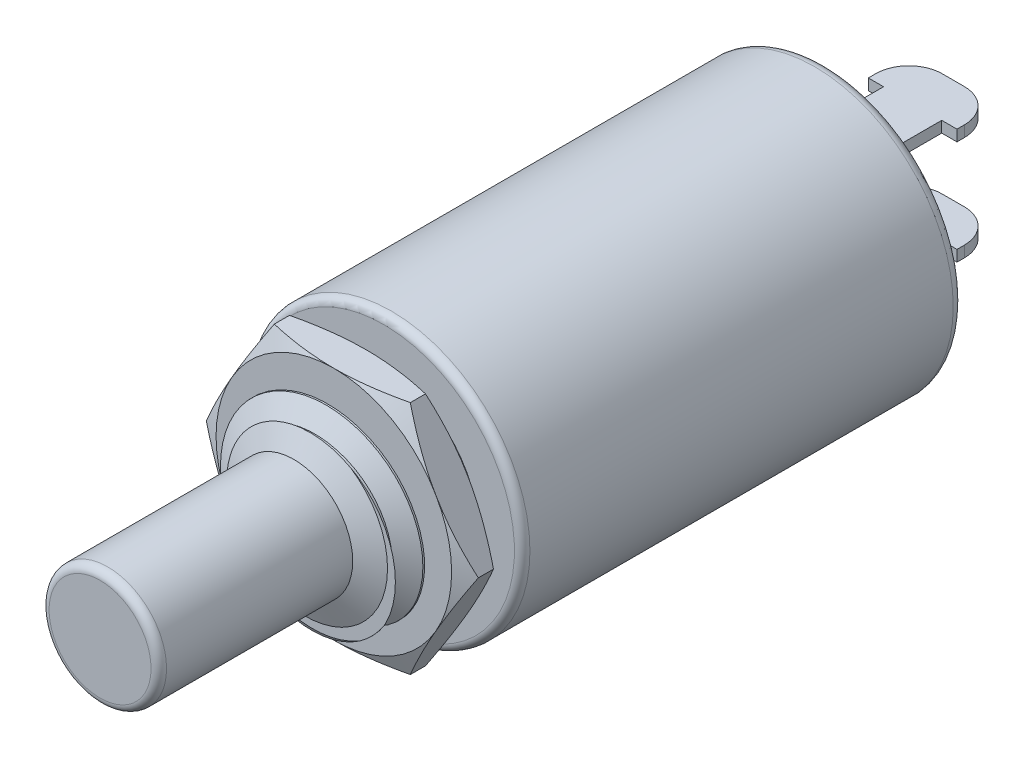
from build123d import *

# Parameters (mm, degrees)
SKETCH2_R                = 1.3462
BOSS_EXTRUDE1_DEPTH      = 4.445
FILLET1_R                = 0.1778
SKETCH3_R                = 2.159
BOSS_EXTRUDE2_DEPTH      = 3.175
CUT_SWEEP1_PITCH         = 0.635
SKETCH10_OUTSIDE_W       = 9.36
SKETCH10_OUTSIDE_H       = 9.36
SKETCH10_OUTSIDE_R       = 1.3462
CUT_EXTRUDE4_DEPTH       = 0.254
CUT_EXTRUDE4_DRAFT       = -65
BOSS_EXTRUDE3_DEPTH      = 0.889
BOSS_EXTRUDE3_DEPTH_BACK = 0.254
SKETCH9_OUTSIDE_W        = 11.572
SKETCH9_OUTSIDE_H        = 10.736
SKETCH9_OUTSIDE_R        = 2.699894512
CUT_EXTRUDE3_DEPTH       = 0.254
CUT_EXTRUDE3_DRAFT       = -65
SKETCH11_R               = 3.175
BOSS_EXTRUDE4_DEPTH      = 10.135165
FILLET2_R                = 0.1778
SKETCH12_W               = 2.032
SKETCH12_H               = 0.254
BOSS_EXTRUDE5_DEPTH      = 2.921
SKETCH13_W               = 0.698555778
SKETCH13_H               = 1.060461926
CUT_EXTRUDE5_DEPTH       = 21.317682156
FILLET3_R                = 0.762
FILLET4_R                = 0.254
SKETCH16_OUTSIDE_W       = 13.744
SKETCH16_OUTSIDE_H       = 13.744
SKETCH16_OUTSIDE_R       = 2.699894512
CUT_EXTRUDE8_DEPTH       = 0.254
CUT_EXTRUDE8_DRAFT       = -65
SKETCH17_R               = 3.117569647
SKETCH17_R_2             = 2.159
CUT_EXTRUDE11_DEPTH      = 0.405835107
SKETCH18_OUTSIDE_W       = 13.744
SKETCH18_OUTSIDE_H       = 13.744
SKETCH18_OUTSIDE_R       = 2.699894512
CUT_EXTRUDE12_DEPTH      = 0.254
CUT_EXTRUDE12_DRAFT      = -65


with BuildPart() as part:
    # Sketch2 → Boss-Extrude1 (new body)
    with BuildSketch(Plane.XY):
        Circle(SKETCH2_R)
    extrude(amount=-BOSS_EXTRUDE1_DEPTH)

    # Fillet1
    fillet1_edges = [part.edges().sort_by_distance(p)[0] for p in [
        (-1.3462, 0, 0),
    ]]
    fillet(fillet1_edges, radius=FILLET1_R)

    # Sketch3 → Boss-Extrude2 (add)
    with BuildSketch(Plane(origin=(0, 0, -4.445), x_dir=(-1, 0, 0), z_dir=(0, 0, -1))):
        Circle(SKETCH3_R)
    extrude(amount=BOSS_EXTRUDE2_DEPTH)

    # Cut-Sweep1: the profile of Sketch5 screwed along a right-hand helix of 5.6 turns, 6 arcs to a turn; built about Z, then put on its axis
    cut_sweep1_z = Axis((0, 0, 0), (0, 0, 1))
    cut_sweep1_corners = [(2.227740766, 0, -0.635), (2.159, 0, 0), (1.712185018, 0, -0.25796875), (1.712185018, 0, -0.33734375)]
    with BuildLine(mode=Mode.PRIVATE) as cut_sweep1_profile:
        Line(cut_sweep1_corners[0], cut_sweep1_corners[1])
        Line(cut_sweep1_corners[1], cut_sweep1_corners[2])
        Line(cut_sweep1_corners[2], cut_sweep1_corners[3])
        Line(cut_sweep1_corners[3], cut_sweep1_corners[0])
    cut_sweep1_cap = Face(cut_sweep1_profile.wire())
    cut_sweep1_turn_angles = [0, 30, 60, 90, 120, 150, 180, 210, 240, 270, 300, 330, 360]
    cut_sweep1_turn_weights = [1, 0.8660254037844387, 1, 0.8660254037844387, 1, 0.8660254037844387, 1, 0.8660254037844387, 1, 0.8660254037844387, 1, 0.8660254037844387, 1]
    cut_sweep1_turn_rails = [Edge.make_bspline([Vector(p[0], p[1], 0).rotate(cut_sweep1_z, cut_sweep1_turn_angles[k]) / cut_sweep1_turn_weights[k] + Vector(0, 0, p[2] + CUT_SWEEP1_PITCH * cut_sweep1_turn_angles[k] / 360) for k in range(13)], [0, 0, 0, 1, 1, 2, 2, 3, 3, 4, 4, 5, 5, 6, 6, 6], 2, cut_sweep1_turn_weights) for p in cut_sweep1_corners]
    cut_sweep1_turn_sides = [Face.make_surface_from_curves(cut_sweep1_turn_rails[p[0]], cut_sweep1_turn_rails[p[1]]) for p in [(0, 1), (1, 2), (2, 3), (3, 0)]]
    cut_sweep1_last_angles = [1800, 1830, 1860, 1890, 1920, 1950, 1980, 1998, 2016]
    cut_sweep1_last_weights = [1, 0.8660254037844387, 1, 0.8660254037844387, 1, 0.8660254037844387, 1, 0.9510565162951469, 1]
    cut_sweep1_last_rails = [Edge.make_bspline([Vector(p[0], p[1], 0).rotate(cut_sweep1_z, cut_sweep1_last_angles[k]) / cut_sweep1_last_weights[k] + Vector(0, 0, p[2] + CUT_SWEEP1_PITCH * cut_sweep1_last_angles[k] / 360) for k in range(9)], [0, 0, 0, 1, 1, 2, 2, 3, 3, 4, 4, 4], 2, cut_sweep1_last_weights) for p in cut_sweep1_corners]
    cut_sweep1_last_sides = [Face.make_surface_from_curves(cut_sweep1_last_rails[p[0]], cut_sweep1_last_rails[p[1]]) for p in [(0, 1), (1, 2), (2, 3), (3, 0)]]
    cut_sweep1 = Plane(origin=(0, 0, -4.445), x_dir=(0, 1, 0), z_dir=(0, 0, -1)) * Solid(Shell([*[p.moved(Location((0, 0, CUT_SWEEP1_PITCH * i))) for i in range(5) for p in cut_sweep1_turn_sides], *cut_sweep1_last_sides, cut_sweep1_cap, cut_sweep1_cap.rotate(cut_sweep1_z, 2016).moved(Location((0, 0, CUT_SWEEP1_PITCH * 2016 / 360)))]))
    add(cut_sweep1, mode=Mode.SUBTRACT)


with BuildPart() as cut_extrude4_tool:
    # Sketch10 outside → Cut-Extrude4 (with draft: the straight prism first)
    with BuildSketch(Plane.XY.offset(-4.445)):
        Rectangle(SKETCH10_OUTSIDE_W, SKETCH10_OUTSIDE_H)
        Circle(SKETCH10_OUTSIDE_R, mode=Mode.SUBTRACT)
    extrude(amount=-CUT_EXTRUDE4_DEPTH)
    # Cut-Extrude4: the draft: its side faces are tilted about the plane it starts from
    cut_extrude4_sides = [cut_extrude4_tool.faces().sort_by_distance(p)[0] for p in [
        (0, -4.68, -4.572),
        (4.68, 0, -4.572),
        (0, 4.68, -4.572),
        (-4.68, 0, -4.572),
        (-1.3462, 0, -4.572),
    ]]
    draft(cut_extrude4_sides, Plane.XY.offset(-4.445), CUT_EXTRUDE4_DRAFT)


with BuildPart() as part_1:
    add(part.part)

    # Cut-Extrude4: cut by cut_extrude4_tool
    add(cut_extrude4_tool.part, mode=Mode.SUBTRACT)


with BuildPart() as body_2:
    # Sketch7 → Boss-Extrude3 (new, two sides: drawn at the far end of the back side and taken through both)
    with BuildSketch(Plane.XY.offset(-6.247835107).offset(-BOSS_EXTRUDE3_DEPTH_BACK)):
        Polygon((1.558784823, -2.699894512), (3.117569647, 0), (1.558784823, 2.699894512), (-1.558784823, 2.699894512), (-3.117569647, 0), (-1.558784823, -2.699894512), align=None)
    extrude(amount=BOSS_EXTRUDE3_DEPTH + BOSS_EXTRUDE3_DEPTH_BACK)


with BuildPart() as cut_extrude3_tool:
    # Sketch9 outside → Cut-Extrude3 (with draft: the straight prism first)
    with BuildSketch(Plane(origin=(0, 0, -6.501835107), x_dir=(-1, 0, 0), z_dir=(0, 0, -1))):
        Rectangle(SKETCH9_OUTSIDE_W, SKETCH9_OUTSIDE_H)
        Circle(SKETCH9_OUTSIDE_R, mode=Mode.SUBTRACT)
    extrude(amount=-CUT_EXTRUDE3_DEPTH)
    # Cut-Extrude3: the draft: its side faces are tilted about the plane it starts from
    cut_extrude3_sides = [cut_extrude3_tool.faces().sort_by_distance(p)[0] for p in [
        (0, -5.368, -6.374835107),
        (-5.786, 0, -6.374835107),
        (0, 5.368, -6.374835107),
        (5.786, 0, -6.374835107),
        (2.699894512, 0, -6.374835107),
    ]]
    draft(cut_extrude3_sides, Plane(origin=(0, 0, -6.501835107), x_dir=(-1, 0, 0), z_dir=(0, 0, -1)), CUT_EXTRUDE3_DRAFT)


with BuildPart() as body_2_1:
    add(body_2.part)

    # Cut-Extrude3: cut by cut_extrude3_tool
    add(cut_extrude3_tool.part, mode=Mode.SUBTRACT)


with BuildPart() as body_3:
    # Sketch11 → Boss-Extrude4 (new body)
    with BuildSketch(Plane(origin=(0, 0, -6.501835107), x_dir=(-1, 0, 0), z_dir=(0, 0, -1))):
        Circle(SKETCH11_R)
    extrude(amount=BOSS_EXTRUDE4_DEPTH)

    # Fillet2
    fillet2_edges = [body_3.edges().sort_by_distance(p)[0] for p in [
        (3.175, 0, -6.501835107),
    ]]
    fillet(fillet2_edges, radius=FILLET2_R)

    # Fillet4
    fillet4_edges = [body_3.edges().sort_by_distance(p)[0] for p in [
        (3.175, 0, -16.637000107),
    ]]
    fillet(fillet4_edges, radius=FILLET4_R)


with BuildPart() as body_4:
    # Sketch12 → Boss-Extrude5 (new body)
    with BuildSketch(Plane(origin=(0, 0, -16.637), x_dir=(-1, 0, 0), z_dir=(0, 0, -1))):
        with Locations((0, 1.1938)):
            Rectangle(SKETCH12_W, SKETCH12_H)
    extrude(amount=BOSS_EXTRUDE5_DEPTH)

    # Sketch13 → Cut-Extrude5 (cut, through all)
    with BuildSketch(Plane(origin=(0, 1.3208, 0), x_dir=(1, 0, 0), z_dir=(0, 1, 0))):
        with Locations((-1.016, 18.0975)):
            Rectangle(SKETCH13_W, SKETCH13_H)
        with Locations((1.016, 18.0975)):
            Rectangle(SKETCH13_W, SKETCH13_H)
    extrude(amount=-CUT_EXTRUDE5_DEPTH, mode=Mode.SUBTRACT)

    # Fillet3
    fillet3_edges = [body_4.edges().sort_by_distance(p)[0] for p in [
        (1.016, 1.1938, -19.558),
        (-1.016, 1.1938, -19.558),
    ]]
    fillet(fillet3_edges, radius=FILLET3_R)


with BuildPart() as body_5:
    # Mirror1: mirrored copy
    add(body_4.part.mirror(Plane.ZX))


with BuildPart() as cut_extrude8_tool:
    # Sketch16 outside → Cut-Extrude8 (with draft: the straight prism first)
    with BuildSketch(Plane.XY.offset(-5.358835107)):
        Rectangle(SKETCH16_OUTSIDE_W, SKETCH16_OUTSIDE_H)
        Circle(SKETCH16_OUTSIDE_R, mode=Mode.SUBTRACT)
    extrude(amount=-CUT_EXTRUDE8_DEPTH)
    # Cut-Extrude8: the draft: its side faces are tilted about the plane it starts from
    cut_extrude8_sides = [cut_extrude8_tool.faces().sort_by_distance(p)[0] for p in [
        (0, -6.872, -5.485835107),
        (6.872, 0, -5.485835107),
        (0, 6.872, -5.485835107),
        (-6.872, 0, -5.485835107),
        (-2.699894512, 0, -5.485835107),
    ]]
    draft(cut_extrude8_sides, Plane.XY.offset(-5.358835107), CUT_EXTRUDE8_DRAFT)


with BuildPart() as body_2_2:
    add(body_2_1.part)

    # Cut-Extrude8: cut by cut_extrude8_tool
    add(cut_extrude8_tool.part, mode=Mode.SUBTRACT)

    # Sketch17 → Cut-Extrude11 (cut)
    with BuildSketch(Plane.XY.offset(-6.096)):
        Circle(SKETCH17_R)
        Circle(SKETCH17_R_2, mode=Mode.SUBTRACT)
    extrude(amount=-CUT_EXTRUDE11_DEPTH, mode=Mode.SUBTRACT)


with BuildPart() as cut_extrude12_tool:
    # Sketch18 outside → Cut-Extrude12 (with draft: the straight prism first)
    with BuildSketch(Plane(origin=(0, 0, -6.096), x_dir=(-1, 0, 0), z_dir=(0, 0, -1))):
        Rectangle(SKETCH18_OUTSIDE_W, SKETCH18_OUTSIDE_H)
        Circle(SKETCH18_OUTSIDE_R, mode=Mode.SUBTRACT)
    extrude(amount=-CUT_EXTRUDE12_DEPTH)
    # Cut-Extrude12: the draft: its side faces are tilted about the plane it starts from
    cut_extrude12_sides = [cut_extrude12_tool.faces().sort_by_distance(p)[0] for p in [
        (0, -6.872, -5.969),
        (-6.872, 0, -5.969),
        (0, 6.872, -5.969),
        (6.872, 0, -5.969),
        (2.699894512, 0, -5.969),
    ]]
    draft(cut_extrude12_sides, Plane(origin=(0, 0, -6.096), x_dir=(-1, 0, 0), z_dir=(0, 0, -1)), CUT_EXTRUDE12_DRAFT)


with BuildPart() as body_2_3:
    add(body_2_2.part)

    # Cut-Extrude12: cut by cut_extrude12_tool
    add(cut_extrude12_tool.part, mode=Mode.SUBTRACT)


solid = Compound([part_1.part, body_3.part, body_4.part, body_5.part, body_2_3.part])
